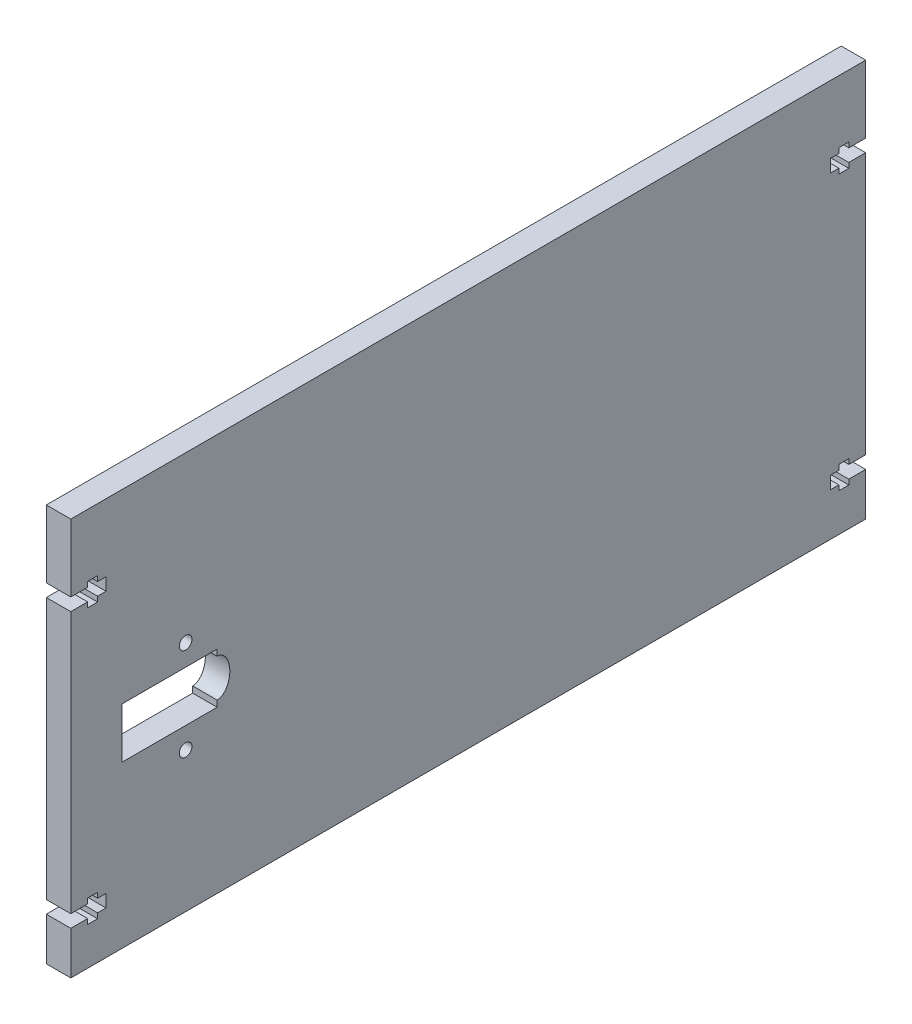
from build123d import *

# Parameters (mm, degrees)
BOSS_EXTRUDE1_OUTLINE_W   = 188.4
BOSS_EXTRUDE1_OUTLINE_H   = 88.4
BOSS_EXTRUDE1_DEPTH       = 5.8
BOSS_EXTRUDE1_2_OUTLINE_R = 1.5
BOSS_EXTRUDE1_2_OUTLINE_W = 22.55
BOSS_EXTRUDE1_2_OUTLINE_H = 11.95
BOSS_EXTRUDE1_2_DEPTH     = 5.8
SKETCH2_W                 = 22.55
SKETCH2_H                 = 11.95
CUT_EXTRUDE1_DEPTH        = 6.35
SKETCH3_R                 = 1.5
SKETCH3_W                 = 22.55
SKETCH3_H                 = 11.95
CUT_EXTRUDE2_DEPTH        = 107.804868803
CUT_EXTRUDE3_DEPTH        = 107.804868803
SKETCH5_W                 = 5.8
SKETCH5_H                 = 188.4
BOSS_EXTRUDE2_DEPTH       = 5.8
CUT_EXTRUDE5_DEPTH        = 5.8


# Read off the part's stored shape, not the designer's step: Boss-Extrude1
with BuildPart() as part:
    # Boss-Extrude1 outline → Boss-Extrude1 (new body)
    with BuildSketch(Plane(origin=(0, 0, 0), x_dir=(0, 0, -1), z_dir=(1, 0, 0))):
        Rectangle(BOSS_EXTRUDE1_OUTLINE_W, BOSS_EXTRUDE1_OUTLINE_H)
    extrude(amount=BOSS_EXTRUDE1_DEPTH)

    # Sketch2 → Cut-Extrude1 (cut)
    with BuildSketch(Plane(origin=(5.8, 0, 0), x_dir=(0, 0, -1), z_dir=(1, 0, 0))):
        with Locations((-70.783988916, 0)):
            Rectangle(SKETCH2_W, SKETCH2_H)
    extrude(amount=-CUT_EXTRUDE1_DEPTH, mode=Mode.SUBTRACT)

    # Sketch3 → Cut-Extrude2 (cut, through all)
    with BuildSketch(Plane(origin=(5.8, 0, 0), x_dir=(0, 0, -1), z_dir=(1, 0, 0))):
        with Locations((-66.978988916, 11)):
            Circle(SKETCH3_R)
        with Locations(Location((-66.978988916, -11, 0), (0, 0, 180))):
            Circle(SKETCH3_R)
        with Locations((-70.783988916, 0)):
            Rectangle(SKETCH3_W, SKETCH3_H)
    extrude(amount=-CUT_EXTRUDE2_DEPTH, mode=Mode.SUBTRACT)

    # Sketch4 → Cut-Extrude3 (cut, through all)
    with BuildSketch(Plane(origin=(5.8, 0, 0), x_dir=(0, 0, -1), z_dir=(1, 0, 0))):
        Polygon((-94.2, 34), (-90.2, 34), (-90.2, 35.21), (-87.85, 35.21), (-87.85, 34), (-85.85, 34), (-85.85, 31), (-87.85, 31), (-87.85, 29.79), (-90.2, 29.79), (-90.2, 31), (-94.2, 31), align=None)
        Polygon((-87.85, -31), (-87.85, -29.79), (-90.2, -29.79), (-90.2, -31), (-94.2, -31), (-94.2, -34), (-90.2, -34), (-90.2, -35.21), (-87.85, -35.21), (-87.85, -34), (-85.85, -34), (-85.85, -31), align=None)
        Polygon((94.2, -34), (90.2, -34), (90.2, -35.21), (87.85, -35.21), (87.85, -34), (85.85, -34), (85.85, -31), (87.85, -31), (87.85, -29.79), (90.2, -29.79), (90.2, -31), (94.2, -31), align=None)
        Polygon((87.85, 31), (87.85, 29.79), (90.2, 29.79), (90.2, 31), (94.2, 31), (94.2, 34), (90.2, 34), (90.2, 35.21), (87.85, 35.21), (87.85, 34), (85.85, 34), (85.85, 31), align=None)
    extrude(amount=-CUT_EXTRUDE3_DEPTH, mode=Mode.SUBTRACT)



with BuildPart() as body_2:
    # Boss-Extrude1 2 outline → Boss-Extrude1 2 (new body)
    with BuildSketch(Plane(origin=(0, 0, 0), x_dir=(0, 0, -1), z_dir=(1, 0, 0))):
        Polygon((94.2, 34), (94.2, 50), (-94.2, 50), (-94.2, 34), (-90.2, 34), (-90.2, 35.21), (-87.85, 35.21), (-87.85, 34), (-85.85, 34), (-85.85, 31), (-87.85, 31), (-87.85, 29.79), (-90.2, 29.79), (-90.2, 31), (-94.2, 31), (-94.2, -31), (-90.2, -31), (-90.2, -29.79), (-87.85, -29.79), (-87.85, -31), (-85.85, -31), (-85.85, -34), (-87.85, -34), (-87.85, -35.21), (-90.2, -35.21), (-90.2, -34), (-94.2, -34), (-94.2, -44.2), (94.2, -44.2), (94.2, -34), (90.2, -34), (90.2, -35.21), (87.85, -35.21), (87.85, -34), (85.85, -34), (85.85, -31), (87.85, -31), (87.85, -29.79), (90.2, -29.79), (90.2, -31), (94.2, -31), (94.2, 31), (90.2, 31), (90.2, 29.79), (87.85, 29.79), (87.85, 31), (85.85, 31), (85.85, 34), (87.85, 34), (87.85, 35.21), (90.2, 35.21), (90.2, 34), align=None)
        with Locations((-66.978988916, -11)):
            Circle(BOSS_EXTRUDE1_2_OUTLINE_R, mode=Mode.SUBTRACT)
        with Locations((-70.783988916, 0)):
            Rectangle(BOSS_EXTRUDE1_2_OUTLINE_W, BOSS_EXTRUDE1_2_OUTLINE_H, mode=Mode.SUBTRACT)
        with Locations((-66.978988916, 11)):
            Circle(BOSS_EXTRUDE1_2_OUTLINE_R, mode=Mode.SUBTRACT)
    extrude(amount=BOSS_EXTRUDE1_2_DEPTH)


with BuildPart() as part_1:
    add(part.part)

    add(body_2.part)  # Boss-Extrude2 merges body 2
    # Sketch5 → Boss-Extrude2 (add)
    with BuildSketch(Plane(origin=(0, 44.2, 0), x_dir=(1, 0, 0), z_dir=(0, 1, 0))):
        with Locations((2.9, 0)):
            Rectangle(SKETCH5_W, SKETCH5_H)
    extrude(amount=BOSS_EXTRUDE2_DEPTH)

    # Sketch8 → Cut-Extrude5 (cut)
    with BuildSketch(Plane(origin=(5.8, 0, 0), x_dir=(0, 0, -1), z_dir=(1, 0, 0))):
        with BuildLine():
            Line((-59.508988916, 4.5), (-59.508988916, -4.5))
            add(Edge.make_bspline(
                [(-59.508988916, -4.5), (-56.508988916, -4.5), (-56.508988916, 0), (-56.508988916, 4.5), (-59.508988916, 4.5)],
                knots=[3.141592654, 3.141592654, 3.141592654, 4.71238898, 4.71238898, 6.283185307, 6.283185307, 6.283185307], degree=2, weights=[1, 0.707106781, 1, 0.707106781, 1]))
        make_face()
    extrude(amount=-CUT_EXTRUDE5_DEPTH, mode=Mode.SUBTRACT)


solid = part_1.part
